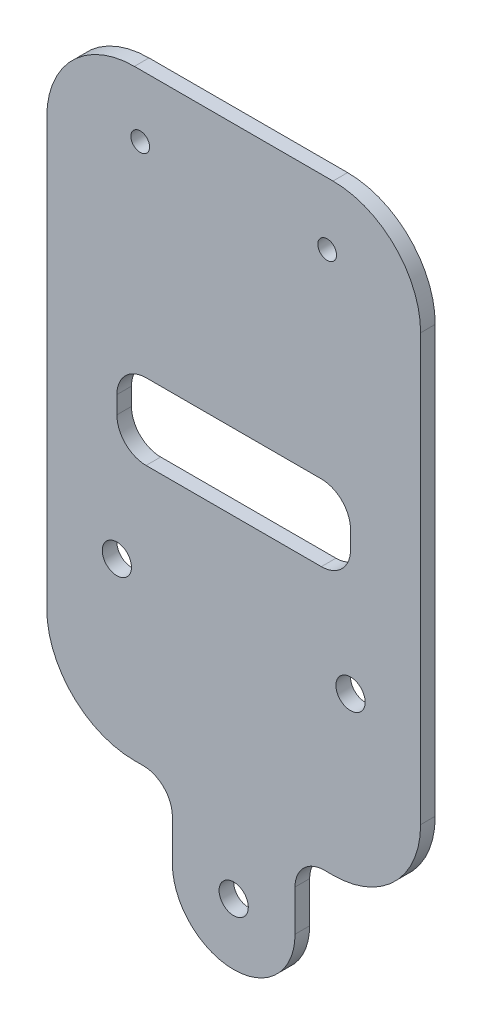
from build123d import *

# Parameters (mm, degrees)
SKETCH2_W           = 200
SKETCH2_H           = 200
BOSS_EXTRUDE1_DEPTH = 2.5
SKETCH3_R           = 2.5
CUT_EXTRUDE1_DEPTH  = 10
CUT_EXTRUDE2_REACH  = 143.443
SKETCH4_W           = 200
SKETCH4_H           = 200
SKETCH4_W_2         = 40
SKETCH4_H_2         = 13
FILLET1_R           = 15
FILLET2_R           = 5
CUT_EXTRUDE4_REACH  = 98.963
SKETCH6_R           = 1.6


with BuildPart() as part:
    # Sketch2 → Boss-Extrude1 (new body)
    with BuildSketch(Plane.XY):
        Rectangle(SKETCH2_W, SKETCH2_H)
    extrude(amount=BOSS_EXTRUDE1_DEPTH)

    # Sketch3 → Cut-Extrude1 (cut)
    with BuildSketch(Plane(origin=(0, 0, 0), x_dir=(-1, 0, 0), z_dir=(0, 0, -1))):
        with Locations((-32.4, 11.65)):
            Circle(SKETCH3_R)
        with Locations((7.6, 11.65)):
            Circle(SKETCH3_R)
        with Locations((-12.4, -28.75)):
            Circle(SKETCH3_R)
    extrude(amount=-CUT_EXTRUDE1_DEPTH, mode=Mode.SUBTRACT)

    # Sketch4 → Cut-Extrude2 (cut, up to next)
    with BuildSketch(Plane.XY.offset(2.5), mode=Mode.PRIVATE) as cut_extrude2_sk1:
        Rectangle(SKETCH4_W, SKETCH4_H)
        with BuildLine():
            Line((-19.6, -16.75), (-19.6, 86.163533864))
            Line((-19.6, 86.163533864), (44.4, 86.163533864))
            Line((44.4, 86.163533864), (44.4, -16.75))
            Line((44.4, -16.75), (22.9, -16.75))
            Line((22.9, -16.75), (22.9, -28.75))
            ThreePointArc((22.9, -28.75), (12.4, -39.25), (1.9, -28.75))
            Line((1.9, -28.75), (1.9, -16.75))
            Line((1.9, -16.75), (-19.6, -16.75))
        make_face(mode=Mode.SUBTRACT)
    cut_extrude2_tool1 = extrude(cut_extrude2_sk1.sketch, amount=-CUT_EXTRUDE2_REACH, mode=Mode.PRIVATE) & part.part
    # Sketch4 → Cut-Extrude2 (cut, up to next)
    with BuildSketch(Plane.XY.offset(2.5), mode=Mode.PRIVATE) as cut_extrude2_sk2:
        with Locations((12.4, 34.5)):
            Rectangle(SKETCH4_W_2, SKETCH4_H_2)
    cut_extrude2_tool2 = extrude(cut_extrude2_sk2.sketch, amount=-CUT_EXTRUDE2_REACH, mode=Mode.PRIVATE) & part.part
    add(cut_extrude2_tool1.solids().sort_by_distance((-97.171573, 0, 2.5))[0], mode=Mode.SUBTRACT)
    add(cut_extrude2_tool2.solids().sort_by_distance((12.4, 34.5, 2.5))[0], mode=Mode.SUBTRACT)

    # Fillet1
    fillet1_edges = [part.edges().sort_by_distance(p)[0] for p in [
        (-19.6, -16.75, 1.25),
        (44.4, -16.75, 1.25),
        (-19.6, 86.163533864, 1.25),
        (44.4, 86.163533864, 1.25),
    ]]
    fillet(fillet1_edges, radius=FILLET1_R)

    # Fillet2
    fillet2_edges = [part.edges().sort_by_distance(p)[0] for p in [
        (-7.6, 41, 1.25),
        (-7.6, 28, 1.25),
        (32.4, 41, 1.25),
        (32.4, 28, 1.25),
        (1.9, -16.75, 1.25),
        (22.9, -16.75, 1.25),
    ]]
    fillet(fillet2_edges, radius=FILLET2_R)

    # Sketch6 → Cut-Extrude4 (cut, up to next)
    with BuildSketch(Plane.XY.offset(2.5), mode=Mode.PRIVATE) as cut_extrude4_sk1:
        with Locations((-3.6, 75.5)):
            Circle(SKETCH6_R)
    cut_extrude4_tool1 = extrude(cut_extrude4_sk1.sketch, amount=-CUT_EXTRUDE4_REACH, mode=Mode.PRIVATE) & part.part
    # Sketch6 → Cut-Extrude4 (cut, up to next)
    with BuildSketch(Plane.XY.offset(2.5), mode=Mode.PRIVATE) as cut_extrude4_sk2:
        with Locations((28.4, 75.5)):
            Circle(SKETCH6_R)
    cut_extrude4_tool2 = extrude(cut_extrude4_sk2.sketch, amount=-CUT_EXTRUDE4_REACH, mode=Mode.PRIVATE) & part.part
    add(cut_extrude4_tool1.solids().sort_by_distance((-3.6, 75.5, 2.5))[0], mode=Mode.SUBTRACT)
    add(cut_extrude4_tool2.solids().sort_by_distance((28.4, 75.5, 2.5))[0], mode=Mode.SUBTRACT)


solid = part.part
